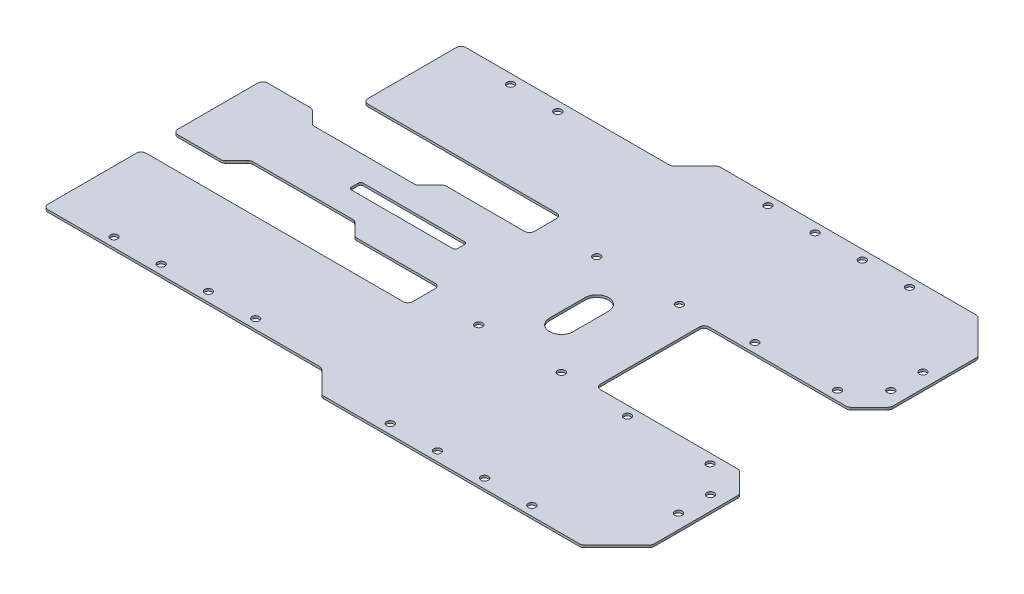
from build123d import *
from build123d.topology import SkipClean

# Parameters (mm, degrees)
SKETCH_1_W          = 70
SKETCH_1_H          = 70
SKETCH_1_R          = 1.6
EXTRUDE_1_DEPTH     = 1
EXTRUDE_2_DEPTH     = 1
SKETCH_5_W          = 113
SKETCH_5_H          = 30
EXTRUDE_5_DEPTH     = 1
SKETCH_6_R          = 1.55
CUT_EXTRUDE_1_DEPTH = 1
SKETCH_7_W          = 15
SKETCH_7_H          = 17.5
EXTRUDE_6_DEPTH     = 1
SKETCH_8_W          = 40
SKETCH_8_H          = 4
SKETCH_8_W_2        = 12
SKETCH_8_W_3        = 27
EXTRUDE_7_DEPTH     = 1
CHAMFER_1_SIZE      = 4
SKETCH_9_W          = 15
SKETCH_9_H          = 13.5
CUT_EXTRUDE_2_DEPTH = 1
CHAMFER_2_SIZE      = 6
SKETCH_10_W         = 45
SKETCH_10_H         = 5
SKETCH_10_W_2       = 70
SKETCH_10_H_2       = 46
CUT_EXTRUDE_3_DEPTH = 10
FILLET_1_R          = 1
SKETCH_11_R         = 1.55
CUT_EXTRUDE_4_DEPTH = 10
CHAMFER_3_SIZE      = 9
FILLET_2_R          = 2
SKETCH_12_R         = 1.55
CUT_EXTRUDE_5_DEPTH = 5
CUT_EXTRUDE_6_DEPTH = 10


# Some blends are built 0.0001 mm under size
with BuildPart() as part:
    # 草图1 → 凸台-拉伸1 (new body)
    with BuildSketch(Plane(origin=(0, 0, 0), x_dir=(1, 0, 0), z_dir=(0, 1, 0))):
        Rectangle(SKETCH_1_W, SKETCH_1_H)
        with Locations(Location((13, -13, 0), (0, 0, 270))):
            Circle(SKETCH_1_R, mode=Mode.SUBTRACT)
        with Locations(Location((13, 13, 0), (0, 0, 270))):
            Circle(SKETCH_1_R, mode=Mode.SUBTRACT)
        with Locations(Location((-13, 13, 0), (0, 0, 270))):
            Circle(SKETCH_1_R, mode=Mode.SUBTRACT)
        with Locations(Location((-13, -13, 0), (0, 0, 270))):
            Circle(SKETCH_1_R, mode=Mode.SUBTRACT)
    extrude(amount=EXTRUDE_1_DEPTH)

    # 草图2 → 凸台-拉伸2 (add)
    with BuildSketch(Plane.XZ):
        Polygon((35, -35), (35, -69), (20, -84), (-90, -84), (-100, -74), (-189, -74), (-189, -32.5), (-105, -32.5), (-105, 32.5), (-218, 32.5), (-218, 74), (-100, 74), (-90, 84), (20, 84), (35, 69), (35, 35), (-35, 35), (-35, -35), align=None)
    extrude(amount=-EXTRUDE_2_DEPTH)

    # 草图5 → 凸台-拉伸5 (add)
    with BuildSketch(Plane(origin=(0, 1, 0), x_dir=(1, 0, 0), z_dir=(0, 1, 0))):
        with Locations((-161.5, 0)):
            Rectangle(SKETCH_5_W, SKETCH_5_H)
    extrude(amount=-EXTRUDE_5_DEPTH)

    # 草图6 → 切除-拉伸1 (cut)
    with BuildSketch(Plane.XZ):
        with Locations(Location((-5, -80, 0), (0, 0, 270))):
            Circle(SKETCH_6_R)
        with Locations(Location((-25, -80, 0), (0, 0, 270))):
            Circle(SKETCH_6_R)
        with Locations(Location((-65, -80, 0), (0, 0, 270))):
            Circle(SKETCH_6_R)
        with Locations(Location((-45, -80, 0), (0, 0, 270))):
            Circle(SKETCH_6_R)
        with Locations(Location((-45, 80, 0), (0, 0, 90))):
            Circle(SKETCH_6_R)
        with Locations(Location((-65, 80, 0), (0, 0, 90))):
            Circle(SKETCH_6_R)
        with Locations(Location((-25, 80, 0), (0, 0, 90))):
            Circle(SKETCH_6_R)
        with Locations(Location((-5, 80, 0), (0, 0, 90))):
            Circle(SKETCH_6_R)
        with Locations(Location((-164, -70, 0), (0, 0, 270))):
            Circle(SKETCH_6_R)
        with Locations(Location((-192, 70, 0), (0, 0, 270))):
            Circle(SKETCH_6_R)
        with Locations(Location((-172, 70, 0), (0, 0, 270))):
            Circle(SKETCH_6_R)
        with Locations(Location((-152, 70, 0), (0, 0, 270))):
            Circle(SKETCH_6_R)
        with Locations(Location((-132, 70, 0), (0, 0, 270))):
            Circle(SKETCH_6_R)
        with Locations(Location((-144, -70, 0), (0, 0, 270))):
            Circle(SKETCH_6_R)
    extrude(amount=-CUT_EXTRUDE_1_DEPTH, mode=Mode.SUBTRACT)

    # 草图7 → 凸台-拉伸6 (add)
    with BuildSketch(Plane.XZ):
        with Locations((-210.5, 23.75)):
            Rectangle(SKETCH_7_W, SKETCH_7_H)
    extrude(amount=-EXTRUDE_6_DEPTH)

    # 草图8 → 凸台-拉伸7 (add)
    with BuildSketch(Plane(origin=(0, 1, 0), x_dir=(1, 0, 0), z_dir=(0, 1, 0))):
        with Locations((-125, 17)):
            Rectangle(SKETCH_8_W, SKETCH_8_H)
        with Locations((-125, -17)):
            Rectangle(SKETCH_8_W, SKETCH_8_H)
        with Locations((-197, -17)):
            Rectangle(SKETCH_8_W_2, SKETCH_8_H)
        with Locations((-204.5, 17)):
            Rectangle(SKETCH_8_W_3, SKETCH_8_H)
    extrude(amount=-EXTRUDE_7_DEPTH)

    # 倒角1
    chamfer_1_edges = [part.edges().sort_by_distance(p)[0] for p in [
        (-145, 0.5, -19),
        (-145, 0.5, 19),
    ]]
    chamfer(chamfer_1_edges, length=CHAMFER_1_SIZE - 0.0001)  # a hair under: the kernel refuses the full size

    # 草图9 → 切除-拉伸2 (cut)
    with SkipClean():  # the faces are left unmerged after this step: merging them gives an invalid solid
        with BuildSketch(Plane(origin=(0, 1, 0), x_dir=(1, 0, 0), z_dir=(0, 1, 0))):
            with Locations((-210.5, -25.75)):
                Rectangle(SKETCH_9_W, SKETCH_9_H)
            Polygon((-145, -15), (-147, -13), (-191, -13), (-191, -15), align=None)
            Polygon((-145, 15), (-191, 15), (-191, 13), (-147, 13), align=None)
        extrude(amount=-CUT_EXTRUDE_2_DEPTH, mode=Mode.SUBTRACT)

    # 倒角2
    # the kernel refuses this chamfer: 6 mm, written as the material it takes off along each edge
    with BuildSketch(Plane(origin=(-191, 16.430097928, -19), x_dir=(0.027495876610586775, 0, 0.9996219169112968), z_dir=(0, -1, 0))) as chamfer_2_piece_1_section:
        Polygon((CHAMFER_2_SIZE * 0.999621916911, CHAMFER_2_SIZE * 0.0274958766106), (-CHAMFER_2_SIZE * 0.0274958766106, CHAMFER_2_SIZE * 0.999621916911), (0, 0), align=None)
    chamfer_2_piece_1 = extrude(amount=31.860195856, mode=Mode.PRIVATE)
    chamfer_2_piece_1 = split(chamfer_2_piece_1, bisect_by=Plane(origin=(-192.982424926, 0.5, -13), z_dir=(0, 0, -1)), keep=Keep.TOP, mode=Mode.PRIVATE)
    add(chamfer_2_piece_1, mode=Mode.SUBTRACT)
    with BuildSketch(Plane(origin=(-191, 16.430097928, 19), x_dir=(-0.9996219169112968, 0, 0.02749587661058619), z_dir=(0, -1, 0))) as chamfer_2_piece_2_section:
        Polygon((CHAMFER_2_SIZE * 0.999621916911, CHAMFER_2_SIZE * 0.0274958766106), (-CHAMFER_2_SIZE * 0.0274958766106, CHAMFER_2_SIZE * 0.999621916911), (0, 0), align=None)
    chamfer_2_piece_2 = extrude(amount=31.860195856, mode=Mode.PRIVATE)
    chamfer_2_piece_2 = split(chamfer_2_piece_2, bisect_by=Plane(origin=(-192.982424926, 0.5, 13), z_dir=(0, 0, 1)), keep=Keep.TOP, mode=Mode.PRIVATE)
    add(chamfer_2_piece_2, mode=Mode.SUBTRACT)

    # 草图10 → 切除-拉伸3 (cut)
    with SkipClean():  # the faces are left unmerged after this step: merging them gives an invalid solid
        with BuildSketch(Plane(origin=(0, 1, 0), x_dir=(1, 0, 0), z_dir=(0, 1, 0))):
            with Locations((-137.5, 0)):
                Rectangle(SKETCH_10_W, SKETCH_10_H)
            Rectangle(SKETCH_10_W_2, SKETCH_10_H_2)
        extrude(amount=-CUT_EXTRUDE_3_DEPTH, mode=Mode.SUBTRACT)

    # 圆角1
    fillet_1_edges = [part.edges().sort_by_distance(p)[0] for p in [
        (-115, 0.5, -2.5),
        (-115, 0.5, 2.5),
        (-160, 0.5, 2.5),
        (-160, 0.5, -2.5),
    ]]
    fillet(fillet_1_edges, radius=FILLET_1_R)

    # 草图11 → 切除-拉伸4 (cut)
    with SkipClean():  # the faces are left unmerged after this step: merging them gives an invalid solid
        with BuildSketch(Plane.XZ):
            with Locations(Location((17.5, -27, 0), (0, 0, 270))):
                Circle(SKETCH_11_R)
            with Locations(Location((17.5, 27, 0), (0, 0, 270))):
                Circle(SKETCH_11_R)
            with Locations(Location((-17.5, 27, 0), (0, 0, 270))):
                Circle(SKETCH_11_R)
            with Locations(Location((-17.5, -27, 0), (0, 0, 270))):
                Circle(SKETCH_11_R)
            with Locations(Location((-47.5, 25, 0), (0, 0, 270))):
                Circle(SKETCH_11_R)
            with Locations(Location((-47.5, -25, 0), (0, 0, 270))):
                Circle(SKETCH_11_R)
            with Locations(Location((-82.5, -25, 0), (0, 0, 270))):
                Circle(SKETCH_11_R)
            with Locations(Location((-82.5, 25, 0), (0, 0, 270))):
                Circle(SKETCH_11_R)
        extrude(amount=-CUT_EXTRUDE_4_DEPTH, mode=Mode.SUBTRACT)

    # 倒角3
    chamfer_3_edges = [part.edges().sort_by_distance(p)[0] for p in [
        (35, 0.5, -23),
        (35, 0.5, 23),
    ]]
    chamfer(chamfer_3_edges, length=CHAMFER_3_SIZE)

    # 圆角2
    fillet_2_edges = [part.edges().sort_by_distance(p)[0] for p in [
        (-105, 0.5, -19),
        (-105, 0.5, 19),
        (-218, 0.5, -19),
        (-141.0001, 0.5, -19),
        (-141.0001, 0.5, 19),
        (-218, 0.5, 32.5),
        (-218, 0.5, 19),
        (-191, 0.5, 13),
        (-147, 0.5, 13),
        (-147, 0.5, -13),
        (-191, 0.5, -13),
        (-197, 0.5, -19),
        (-197, 0.5, 19),
        (35, 0.5, -69),
        (20, 0.5, -84),
        (-90, 0.5, -84),
        (-100, 0.5, -74),
        (-189, 0.5, -74),
        (-35, 0.5, 23),
        (-35, 0.5, -23),
        (-189, 0.5, -32.5),
        (-105, 0.5, -32.5),
        (-105, 0.5, 32.5),
        (-218, 0.5, 74),
        (-100, 0.5, 74),
        (-90, 0.5, 84),
        (20, 0.5, 84),
        (35, 0.5, 69),
        (35, 0.5, 32),
        (26, 0.5, 23),
        (35, 0.5, -32),
        (26, 0.5, -23),
    ]]
    fillet(fillet_2_edges, radius=FILLET_2_R)

    # 草图12 → 切除-拉伸5 (cut)
    with SkipClean():  # the faces are left unmerged after this step: merging them gives an invalid solid
        with BuildSketch(Plane.XZ):
            with Locations(Location((28.9, 38.2, 0), (0, 0, 270))):
                Circle(SKETCH_12_R)
            with Locations(Location((28.9, 51.8, 0), (0, 0, 270))):
                Circle(SKETCH_12_R)
            with Locations(Location((28.9, -38.2, 0), (0, 0, 270))):
                Circle(SKETCH_12_R)
            with Locations(Location((28.9, -51.8, 0), (0, 0, 270))):
                Circle(SKETCH_12_R)
        extrude(amount=-CUT_EXTRUDE_5_DEPTH, mode=Mode.SUBTRACT)

    # 草图13 → 切除-拉伸6 (cut)
    with SkipClean():  # the faces are left unmerged after this step: merging them gives an invalid solid
        with BuildSketch(Plane.XZ):
            with BuildLine():
                Line((-60, 7.5), (-60, -7.5))
                ThreePointArc((-60, -7.5), (-65, -12.5), (-70, -7.5))
                Line((-70, -7.5), (-70, 7.5))
                ThreePointArc((-70, 7.5), (-65, 12.5), (-60, 7.5))
            make_face()
        extrude(amount=-CUT_EXTRUDE_6_DEPTH, mode=Mode.SUBTRACT)


solid = part.part
